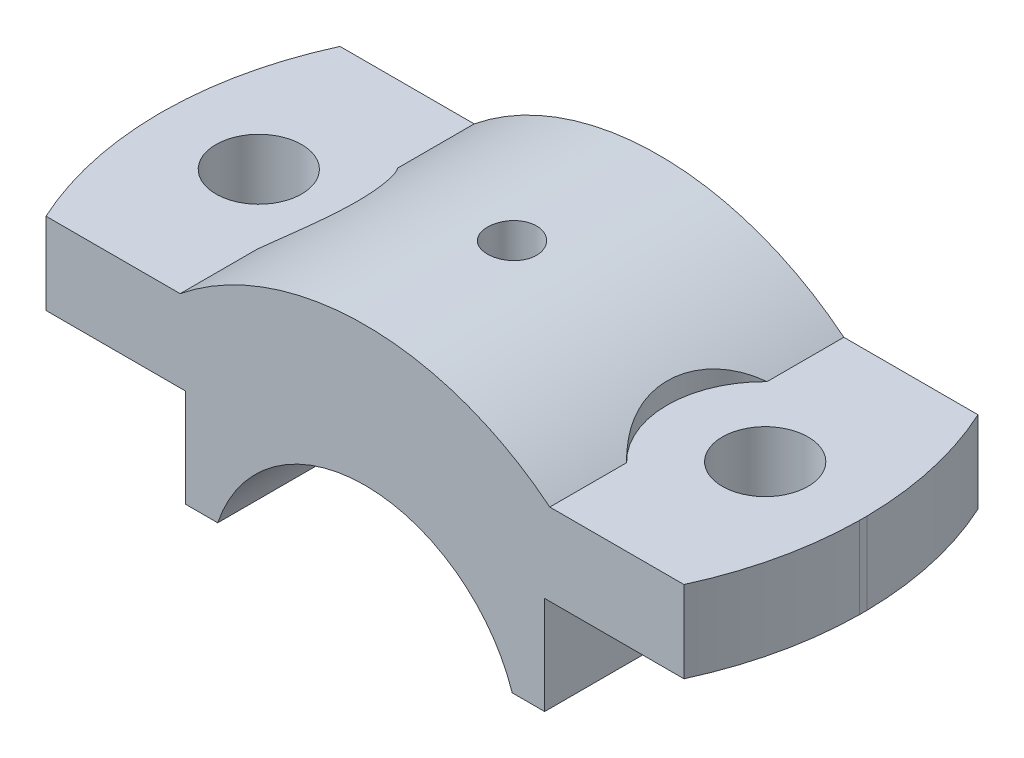
from build123d import *

# Parameters (mm, degrees)
BOSS_EXTRUDE1_DEPTH     = 18
SKETCH2_R               = 5.25
CUT_EXTRUDE1_DEPTH      = 52.54422425
CUT_EXTRUDE2_START      = -10
CUT_EXTRUDE2_DEPTH      = 10
CUT_EXTRUDE3_DEPTH      = 52.54422425
CUT_EXTRUDE4_DEPTH      = 52.544224284
SKETCH6_R               = 3
CUT_EXTRUDE5_DEPTH      = 10
CUT_EXTRUDE6_REACH      = 52.806
CUT_EXTRUDE6_END_RADIUS = 19
SKETCH7_R               = 1.5


# Read off the part's stored shape, not the designer's step: Cut-Extrude2
with BuildPart() as part:
    # Sketch1 → Boss-Extrude1 (new, symmetric)
    with BuildSketch(Plane.XY):
        with BuildLine():
            Line((22.627416998, 17.790398646), (42.997756377, 17.790398646))
            Line((42.997756377, 17.790398646), (42.997756377, 7.790398646))
            Line((42.997756377, 7.790398646), (21.997756377, 7.790398646))
            Line((21.997756377, 7.790398646), (21.997756377, -4.209601354))
            Line((21.997756377, -4.209601354), (18.027756377, -4.209601354))
            ThreePointArc((18.027756377, -4.209601354), (0, 8.790398646), (-18.027756377, -4.209601354))
            Line((-18.027756377, -4.209601354), (-21.997756377, -4.209601354))
            Line((-21.997756377, -4.209601354), (-21.997756377, 7.790398646))
            Line((-21.997756377, 7.790398646), (-42.997756377, 7.790398646))
            Line((-42.997756377, 7.790398646), (-42.997756377, 17.790398646))
            Line((-42.997756377, 17.790398646), (-22.627416998, 17.790398646))
            ThreePointArc((-22.627416998, 17.790398646), (0, 25.790398646), (22.627416998, 17.790398646))
        make_face()
    extrude(amount=BOSS_EXTRUDE1_DEPTH, both=True)

    # Sketch2 → Cut-Extrude1 (cut, through all)
    with BuildSketch(Plane(origin=(0, 17.790398646, 0), x_dir=(1, 0, 0), z_dir=(0, 1, 0))):
        with Locations(Location((-31, 0, 0), (0, 0, 180))):
            Circle(SKETCH2_R)
        with Locations(Location((31, 0, 0), (0, 0, 180))):
            Circle(SKETCH2_R)
    extrude(amount=-CUT_EXTRUDE1_DEPTH, mode=Mode.SUBTRACT)

    # Cut-Extrude2 outline → Cut-Extrude2 (cut)
    with BuildSketch(Plane(origin=(0, 17.790398646, 0), x_dir=(1, 0, 0), z_dir=(0, 1, 0)).offset(CUT_EXTRUDE2_START)):
        with BuildLine():
            ThreePointArc((39.05124838, 18), (41.953602003, 9.428429295), (42.997756377, 0.439256778))
            Line((42.997756377, 0.439256778), (42.997756377, 18))
            Line((42.997756377, 18), (39.05124838, 18))
        make_face()
        with BuildLine():
            Line((42.997756377, -18), (42.997756377, -0.439256778))
            ThreePointArc((42.997756377, -0.439256778), (41.953602003, -9.428429295), (39.05124838, -18))
            Line((39.05124838, -18), (42.997756377, -18))
        make_face()
        with BuildLine():
            ThreePointArc((-42.997756377, 0.439256778), (-41.953602003, 9.428429295), (-39.05124838, 18))
            Line((-39.05124838, 18), (-42.997756377, 18))
            Line((-42.997756377, 18), (-42.997756377, 0.439256778))
        make_face()
        with BuildLine():
            Line((-42.997756377, -18), (-39.05124838, -18))
            ThreePointArc((-39.05124838, -18), (-41.953602003, -9.428429295), (-42.997756377, -0.439256778))
            Line((-42.997756377, -0.439256778), (-42.997756377, -18))
        make_face()
    extrude(amount=CUT_EXTRUDE2_DEPTH, mode=Mode.SUBTRACT)

    # Sketch4 → Cut-Extrude3 (cut, through all)
    with BuildSketch(Plane(origin=(0, 17.790398646, 0), x_dir=(1, 0, 0), z_dir=(0, 1, 0))):
        with BuildLine():
            Line((-22.627416998, 8.596502421), (-22.627416998, -8.596502421))
            ThreePointArc((-22.627416998, -8.596502421), (-19, 0), (-22.627416998, 8.596502421))
        make_face()
    extrude(amount=CUT_EXTRUDE3_DEPTH, mode=Mode.SUBTRACT)

    # Sketch5 → Cut-Extrude4 (cut, through all)
    with BuildSketch(Plane(origin=(0, 17.790398646, 0), x_dir=(1, 0, 0), z_dir=(0, 1, 0))):
        with BuildLine():
            Line((22.627416998, 8.596502421), (22.627416998, -8.596502421))
            ThreePointArc((22.627416998, -8.596502421), (19, 0), (22.627416998, 8.596502421))
        make_face()
    extrude(amount=CUT_EXTRUDE4_DEPTH, mode=Mode.SUBTRACT)

    # Sketch6 → Cut-Extrude5 (cut)
    with BuildSketch(Plane(origin=(0, 26, 0), x_dir=(1, 0, 0), z_dir=(0, 1, 0))):
        with Locations(Location((0, 0, 0), (0, 0, 270))):
            Circle(SKETCH6_R)
    extrude(amount=-CUT_EXTRUDE5_DEPTH, mode=Mode.SUBTRACT)

    # Cut-Extrude6: up to this cylinder (the profile starts outside it)
    cut_extrude6_end = Plane(origin=(0, -10.209601354, 0), z_dir=(0, 0, -1)) * Cylinder(CUT_EXTRUDE6_END_RADIUS, 144.612, mode=Mode.PRIVATE)
    # Sketch7 → Cut-Extrude6 (cut, up to the surface)
    with BuildSketch(Plane(origin=(0, 16, 0), x_dir=(1, 0, 0), z_dir=(0, 1, 0)), mode=Mode.PRIVATE) as cut_extrude6_sk1:
        with Locations(Location((0, 0, 0), (0, 0, 270))):
            Circle(SKETCH7_R)
    cut_extrude6_tool1 = extrude(cut_extrude6_sk1.sketch, amount=-CUT_EXTRUDE6_REACH, mode=Mode.PRIVATE) - cut_extrude6_end
    add(cut_extrude6_tool1.solids().sort_by_distance((0, 16, 0))[0], mode=Mode.SUBTRACT)


solid = part.part
